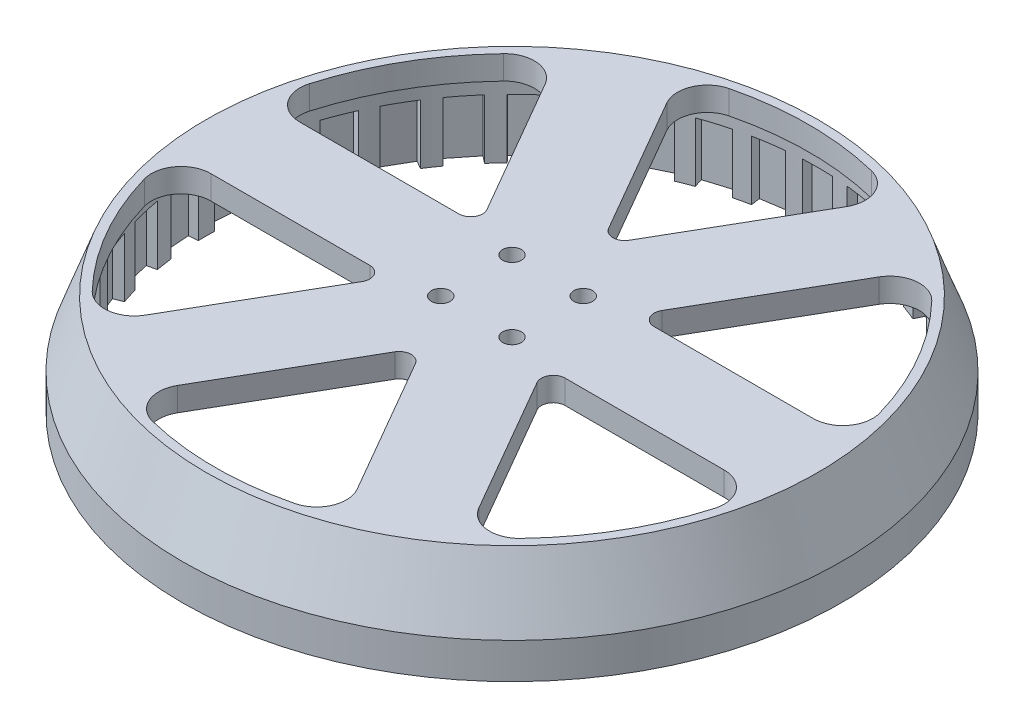
from build123d import *

# Parameters (mm, degrees)
SLOT_CUT_DEPTH           = 81.308779097
SLOT_CUT_PATTERN_COUNT   = 6
MAGNET_START             = -10
MAGNET_SLOTS_DEPTH       = 10
MAGNET_CUT_PATTERN_COUNT = 42
SKETCH5_R                = 1.575
CUT_EXTRUDE1_DEPTH       = 10
CHAMFER1_SIZE            = 4
CHAMFER1_SIZE2           = 10.989909678


with BuildPart() as part:
    # Sketch1 → Main Revolve (revolve)
    with BuildSketch(Plane.XY):
        Polygon((0, 29), (0, 33), (55.5, 33), (55.5, 16), (51.5, 16), (51.5, 29), align=None)
    revolve(axis=Axis((0, 0, 0), (0, 1, 0)))

    # Sketch2 → Slot Cut (cut, through all)
    with BuildSketch(Plane(origin=(0, 33, 0), x_dir=(1, 0, 0), z_dir=(0, 1, 0))):
        with BuildLine():
            Line((15.119330054, 41.18744783), (1.732050808, 18))
            ThreePointArc((1.732050808, 18), (0, 17), (-1.732050808, 18))
            Line((-1.732050808, 18), (-15.119330054, 41.18744783))
            ThreePointArc((-15.119330054, 41.18744783), (-15.389548669, 45.646228074), (-11.988003372, 48.5416087))
            ThreePointArc((-11.988003372, 48.5416087), (0, 50), (11.988003372, 48.5416087))
            ThreePointArc((11.988003372, 48.5416087), (15.389548669, 45.646228074), (15.119330054, 41.18744783))
        make_face()
    slot_cut = extrude(amount=-SLOT_CUT_DEPTH, mode=Mode.SUBTRACT)

    # Slot Cut Pattern: Slot Cut ×6 about axis
    slot_cut_pattern_axis = Axis((0, 33, 0), (0, -1, 0))
    for i in range(1, SLOT_CUT_PATTERN_COUNT):
        add(slot_cut.rotate(slot_cut_pattern_axis, i * 360 / SLOT_CUT_PATTERN_COUNT), mode=Mode.SUBTRACT)

    # Sketch4 → Magnet Slots (cut)
    with BuildSketch(Plane.XZ.offset(-16).offset(MAGNET_START)):
        with BuildLine():
            Line((-2.5, 53), (2.5, 53))
            Line((2.5, 53), (2.5, 51.439284598))
            ThreePointArc((2.5, 51.439284598), (0, 51.5), (-2.5, 51.439284598))
            Line((-2.5, 51.439284598), (-2.5, 53))
        make_face()
    magnet_slots = extrude(amount=MAGNET_SLOTS_DEPTH, mode=Mode.SUBTRACT)

    # Magnet Cut Pattern: Magnet Slots ×42 about axis
    magnet_cut_pattern_axis = Axis((0, 16, 0), (0, -1, 0))
    for i in range(1, MAGNET_CUT_PATTERN_COUNT):
        add(magnet_slots.rotate(magnet_cut_pattern_axis, i * 360 / MAGNET_CUT_PATTERN_COUNT), mode=Mode.SUBTRACT)

    # Sketch5 → Cut-Extrude1 (cut)
    with BuildSketch(Plane(origin=(0, 33, 0), x_dir=(1, 0, 0), z_dir=(0, 1, 0))):
        with Locations((-6, 6)):
            Circle(SKETCH5_R)
        with Locations((6, 6)):
            Circle(SKETCH5_R)
        with Locations((6, -6)):
            Circle(SKETCH5_R)
        with Locations((-6, -6)):
            Circle(SKETCH5_R)
    extrude(amount=-CUT_EXTRUDE1_DEPTH, mode=Mode.SUBTRACT)

    # Chamfer1
    chamfer1_edges = [part.edges().sort_by_distance(p)[0] for p in [
        (-55.5, 33, 0),
    ]]
    chamfer1_side = [part.faces().sort_by_distance(p)[0] for p in [
        (0, 33, 0),
    ]]
    chamfer(chamfer1_edges, length=CHAMFER1_SIZE, length2=CHAMFER1_SIZE2, reference=chamfer1_side[0])


solid = part.part
